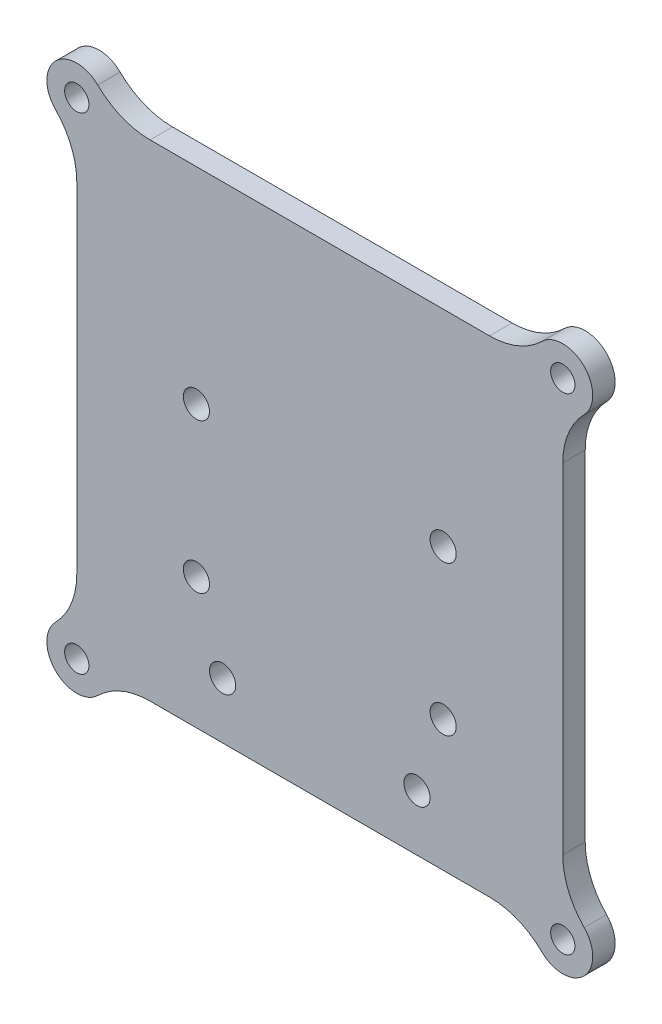
from build123d import *

# Parameters (mm, degrees)
SKETCH_1_R          = 1.625
EXTRUDE_1_DEPTH     = 3
FILLET_1_R          = 10
SKETCH_2_R          = 1.75
CUT_EXTRUDE_1_DEPTH = 10
SKETCH_4_R          = 1.75
CUT_EXTRUDE_2_DEPTH = 10
SKETCH_5_R          = 1.75
CUT_EXTRUDE_3_DEPTH = 10


with BuildPart() as part:
    # Эскиз1 → Бобышка-Вытянуть1 (new body)
    with BuildSketch(Plane.XY):
        with BuildLine():
            Line((-32.5, 28.5), (-32.5, -28.5))
            ThreePointArc((-32.5, -28.5), (-35.328427125, -35.328427125), (-28.5, -32.5))
            Line((-28.5, -32.5), (28.5, -32.5))
            ThreePointArc((28.5, -32.5), (35.328427125, -35.328427125), (32.5, -28.5))
            Line((32.5, -28.5), (32.5, 28.5))
            ThreePointArc((32.5, 28.5), (35.328427125, 35.328427125), (28.5, 32.5))
            Line((28.5, 32.5), (-28.5, 32.5))
            ThreePointArc((-28.5, 32.5), (-35.328427125, 35.328427125), (-32.5, 28.5))
        make_face()
        with Locations((-32.5, -32.5)):
            Circle(SKETCH_1_R, mode=Mode.SUBTRACT)
        with Locations((-32.5, 32.5)):
            Circle(SKETCH_1_R, mode=Mode.SUBTRACT)
        with Locations((32.5, 32.5)):
            Circle(SKETCH_1_R, mode=Mode.SUBTRACT)
        with Locations((32.5, -32.5)):
            Circle(SKETCH_1_R, mode=Mode.SUBTRACT)
    extrude(amount=EXTRUDE_1_DEPTH)

    # Скругление1
    fillet_1_edges = [part.edges().sort_by_distance(p)[0] for p in [
        (-28.5, -32.5, 1.5),
        (-32.5, -28.5, 1.5),
        (-28.5, 32.5, 1.5),
        (-32.5, 28.5, 1.5),
        (28.5, 32.5, 1.5),
        (32.5, 28.5, 1.5),
        (32.5, -28.5, 1.5),
        (28.5, -32.5, 1.5),
    ]]
    fillet(fillet_1_edges, radius=FILLET_1_R)

    # Эскиз2 → Вырез-Вытянуть1 (cut)
    with BuildSketch(Plane.XY.offset(3)):
        with Locations((-13, -25)):
            Circle(SKETCH_2_R)
        with Locations((13, -25)):
            Circle(SKETCH_2_R)
    extrude(amount=-CUT_EXTRUDE_1_DEPTH, mode=Mode.SUBTRACT)

    # Эскиз4 → Вырез-Вытянуть2 (cut)
    with BuildSketch(Plane.XY.offset(3)):
        with Locations((-16.5, -15)):
            Circle(SKETCH_4_R)
        with Locations((16.5, -15)):
            Circle(SKETCH_4_R)
    extrude(amount=-CUT_EXTRUDE_2_DEPTH, mode=Mode.SUBTRACT)

    # Эскиз5 → Вырез-Вытянуть3 (cut)
    with BuildSketch(Plane.XY.offset(3)):
        with Locations((-16.5, 5)):
            Circle(SKETCH_5_R)
        with Locations((16.5, 5)):
            Circle(SKETCH_5_R)
    extrude(amount=-CUT_EXTRUDE_3_DEPTH, mode=Mode.SUBTRACT)


solid = part.part
